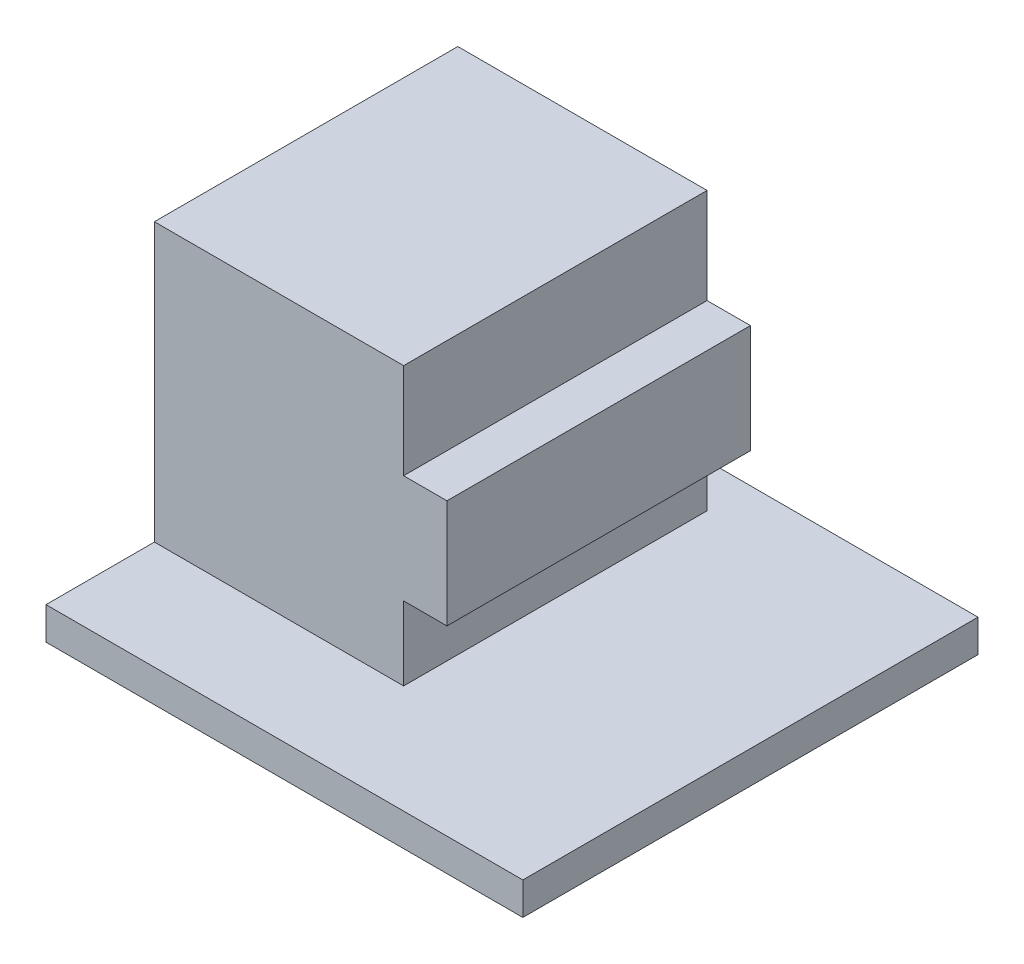
from build123d import *

# Parameters (mm, degrees)
SKETCH1_W           = 22
SKETCH1_H           = 21
BOSS_EXTRUDE1_DEPTH = 1.5
BOSS_EXTRUDE3_DEPTH = 14


with BuildPart() as part:
    # Sketch1 → Boss-Extrude1 (new body)
    with BuildSketch(Plane(origin=(0, 0, 0), x_dir=(1, 0, 0), z_dir=(0, 1, 0))):
        with Locations((11, 10.5)):
            Rectangle(SKETCH1_W, SKETCH1_H)
    extrude(amount=BOSS_EXTRUDE1_DEPTH)

    # Sketch3 → Boss-Extrude3 (add)
    with BuildSketch(Plane(origin=(0, 0, -19), x_dir=(-1, 0, 0), z_dir=(0, 0, -1))):
        Polygon((0, 1.5), (0, 14.3), (-11.5, 14.3), (-11.5, 9.9), (-13.5, 9.9), (-13.5, 4.9), (-11.5, 4.9), (-11.5, 1.5), align=None)
    extrude(amount=-BOSS_EXTRUDE3_DEPTH)


solid = part.part
